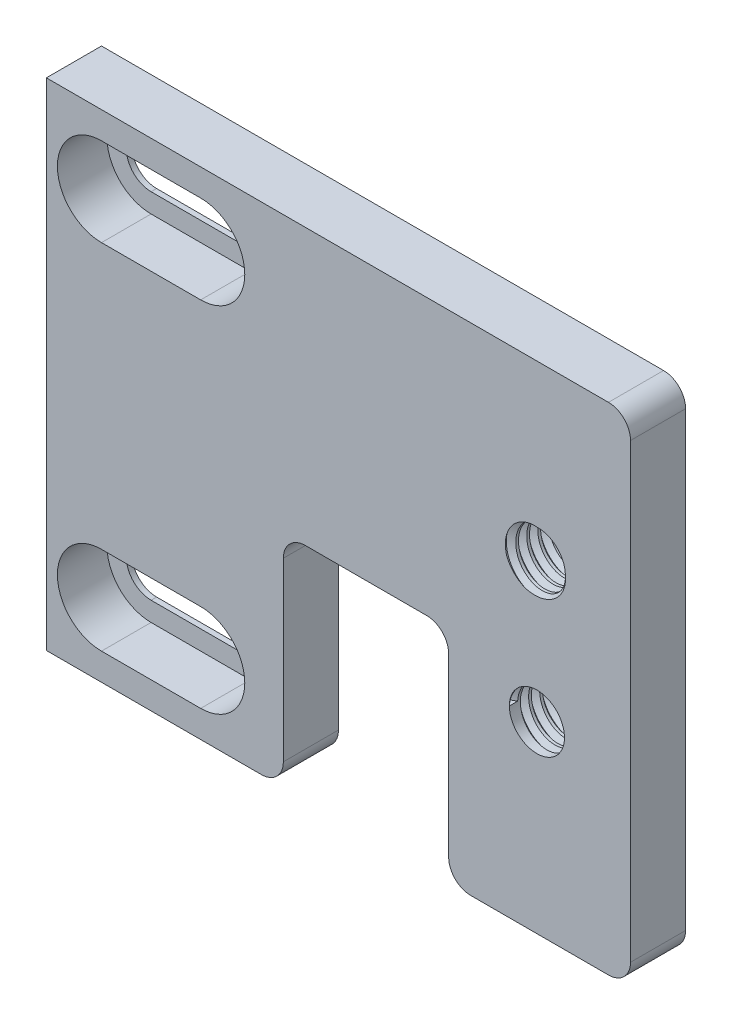
from build123d import *

# Parameters (mm, degrees)
BOSS_EXTRUDE1_DEPTH = 5
CUT_EXTRUDE2_DEPTH  = 4.5
CUT_EXTRUDE3_DEPTH  = 57.732425569
SKETCH4_R           = 2.5
CUT_EXTRUDE4_DEPTH  = 57.774273319
THREAD3_PITCH       = 1
THREAD4_PITCH       = 1


with BuildPart() as part:
    # Sketch1 → Boss-Extrude1 (new body)
    with BuildSketch(Plane.XY):
        with BuildLine():
            Line((-34.253731343, 0), (-34.253731343, 45))
            Line((-34.253731343, 45), (16.746268657, 45))
            ThreePointArc((16.746268657, 45), (18.160482219, 44.414213562), (18.746268657, 43))
            Line((18.746268657, 43), (18.746268657, 2))
            ThreePointArc((18.746268657, 2), (18.160482219, 0.585786438), (16.746268657, 0))
            Line((16.746268657, 0), (4.246268657, 0))
            ThreePointArc((4.246268657, 0), (2.832055094, 0.585786438), (2.246268657, 2))
            Line((2.246268657, 2), (2.246268657, 18))
            ThreePointArc((2.246268657, 18), (1.660482219, 19.414213562), (0.246268657, 20))
            Line((0.246268657, 20), (-10.753731343, 20))
            ThreePointArc((-10.753731343, 20), (-12.167944906, 19.414213562), (-12.753731343, 18))
            Line((-12.753731343, 18), (-12.753731343, 2))
            ThreePointArc((-12.753731343, 2), (-13.339517781, 0.585786438), (-14.753731343, 0))
            Line((-14.753731343, 0), (-34.253731343, 0))
        make_face()
    extrude(amount=BOSS_EXTRUDE1_DEPTH)

    # Sketch2 → Cut-Extrude2 (cut)
    with BuildSketch(Plane.XY.offset(5)):
        with BuildLine():
            Line((-29.253731343, 42.55), (-20.253731343, 42.55))
            ThreePointArc((-20.253731343, 42.55), (-16.253731343, 38.55), (-20.253731343, 34.55))
            Line((-20.253731343, 34.55), (-29.253731343, 34.55))
            ThreePointArc((-29.253731343, 34.55), (-33.253731343, 38.55), (-29.253731343, 42.55))
        make_face()
        with BuildLine():
            Line((-29.253731343, 10.45), (-20.253731343, 10.45))
            ThreePointArc((-20.253731343, 10.45), (-16.253731343, 6.45), (-20.253731343, 2.45))
            Line((-20.253731343, 2.45), (-29.253731343, 2.45))
            ThreePointArc((-29.253731343, 2.45), (-33.253731343, 6.45), (-29.253731343, 10.45))
        make_face()
    extrude(amount=-CUT_EXTRUDE2_DEPTH, mode=Mode.SUBTRACT)

    # Sketch3 → Cut-Extrude3 (cut, through all)
    with BuildSketch(Plane.XY.offset(0.5)):
        with BuildLine():
            Line((-29.253731343, 8.7), (-20.253731343, 8.7))
            ThreePointArc((-20.253731343, 8.7), (-18.003731343, 6.45), (-20.253731343, 4.2))
            Line((-20.253731343, 4.2), (-29.253731343, 4.2))
            ThreePointArc((-29.253731343, 4.2), (-31.503731343, 6.45), (-29.253731343, 8.7))
        make_face()
        with BuildLine():
            Line((-29.253731343, 40.8), (-20.253731343, 40.8))
            ThreePointArc((-20.253731343, 40.8), (-18.003731343, 38.55), (-20.253731343, 36.3))
            Line((-20.253731343, 36.3), (-29.253731343, 36.3))
            ThreePointArc((-29.253731343, 36.3), (-31.503731343, 38.55), (-29.253731343, 40.8))
        make_face()
    extrude(amount=-CUT_EXTRUDE3_DEPTH, mode=Mode.SUBTRACT)

    # Sketch4 → Cut-Extrude4 (cut, through all)
    with BuildSketch(Plane.XY.offset(5)):
        with Locations((10.256268657, 16.65)):
            Circle(SKETCH4_R)
        with Locations((10.336268657, 29.45)):
            Circle(SKETCH4_R)
    extrude(amount=-CUT_EXTRUDE4_DEPTH, mode=Mode.SUBTRACT)

    # Thread3: the profile of Thread Profile3 profile screwed along a right-hand helix of 5 turns, 8 arcs to a turn; built about Z, then put on its axis
    thread3_z = Axis((0, 0, 0), (0, 0, 1))
    thread3_corners = [(2.4997, 0, -0.000173205), (3.041265875, 0, 0.312499999), (3.041265875, 0, 0.437499999), (2.4997, 0, 0.750173202)]
    with BuildLine(mode=Mode.PRIVATE) as thread3_profile:
        Line(thread3_corners[0], thread3_corners[1])
        Line(thread3_corners[1], thread3_corners[2])
        Line(thread3_corners[2], thread3_corners[3])
        Line(thread3_corners[3], thread3_corners[0])
    thread3_cap = Face(thread3_profile.wire())
    thread3_turn_angles = [0, 22.5, 45, 67.5, 90, 112.5, 135, 157.5, 180, 202.5, 225, 247.5, 270, 292.5, 315, 337.5, 360]
    thread3_turn_weights = [1, 0.9238795325112867, 1, 0.9238795325112867, 1, 0.9238795325112867, 1, 0.9238795325112867, 1, 0.9238795325112867, 1, 0.9238795325112867, 1, 0.9238795325112867, 1, 0.9238795325112867, 1]
    thread3_turn_rails = [Edge.make_bspline([Vector(p[0], p[1], 0).rotate(thread3_z, thread3_turn_angles[k]) / thread3_turn_weights[k] + Vector(0, 0, p[2] + THREAD3_PITCH * thread3_turn_angles[k] / 360) for k in range(17)], [0, 0, 0, 1, 1, 2, 2, 3, 3, 4, 4, 5, 5, 6, 6, 7, 7, 8, 8, 8], 2, thread3_turn_weights) for p in thread3_corners]
    thread3_turn_sides = [Face.make_surface_from_curves(thread3_turn_rails[p[0]], thread3_turn_rails[p[1]]) for p in [(0, 1), (1, 2), (2, 3), (3, 0)]]
    thread3 = Plane(origin=(10.336268657, 29.45, 0), x_dir=(1, 0, 0), z_dir=(0, 0, 1)) * Solid(Shell([*[p.moved(Location((0, 0, THREAD3_PITCH * i))) for i in range(5) for p in thread3_turn_sides], thread3_cap, thread3_cap.rotate(thread3_z, 1800).moved(Location((0, 0, THREAD3_PITCH * 1800 / 360)))]))
    add(thread3, mode=Mode.SUBTRACT)

    # Thread4: the profile of Thread Profile4 profile screwed along a right-hand helix of 5 turns, 8 arcs to a turn; built about Z, then put on its axis
    thread4_z = Axis((0, 0, 0), (0, 0, 1))
    thread4_corners = [(2.4997, 0, -0.000173205), (3.041265875, 0, 0.312499999), (3.041265875, 0, 0.437499999), (2.4997, 0, 0.750173202)]
    with BuildLine(mode=Mode.PRIVATE) as thread4_profile:
        Line(thread4_corners[0], thread4_corners[1])
        Line(thread4_corners[1], thread4_corners[2])
        Line(thread4_corners[2], thread4_corners[3])
        Line(thread4_corners[3], thread4_corners[0])
    thread4_cap = Face(thread4_profile.wire())
    thread4_turn_angles = [0, 22.5, 45, 67.5, 90, 112.5, 135, 157.5, 180, 202.5, 225, 247.5, 270, 292.5, 315, 337.5, 360]
    thread4_turn_weights = [1, 0.9238795325112867, 1, 0.9238795325112867, 1, 0.9238795325112867, 1, 0.9238795325112867, 1, 0.9238795325112867, 1, 0.9238795325112867, 1, 0.9238795325112867, 1, 0.9238795325112867, 1]
    thread4_turn_rails = [Edge.make_bspline([Vector(p[0], p[1], 0).rotate(thread4_z, thread4_turn_angles[k]) / thread4_turn_weights[k] + Vector(0, 0, p[2] + THREAD4_PITCH * thread4_turn_angles[k] / 360) for k in range(17)], [0, 0, 0, 1, 1, 2, 2, 3, 3, 4, 4, 5, 5, 6, 6, 7, 7, 8, 8, 8], 2, thread4_turn_weights) for p in thread4_corners]
    thread4_turn_sides = [Face.make_surface_from_curves(thread4_turn_rails[p[0]], thread4_turn_rails[p[1]]) for p in [(0, 1), (1, 2), (2, 3), (3, 0)]]
    thread4 = Plane(origin=(10.256268657, 16.65, 5), x_dir=(-1, 0, 0), z_dir=(0, 0, -1)) * Solid(Shell([*[p.moved(Location((0, 0, THREAD4_PITCH * i))) for i in range(5) for p in thread4_turn_sides], thread4_cap, thread4_cap.rotate(thread4_z, 1800).moved(Location((0, 0, THREAD4_PITCH * 1800 / 360)))]))
    add(thread4, mode=Mode.SUBTRACT)


solid = part.part
